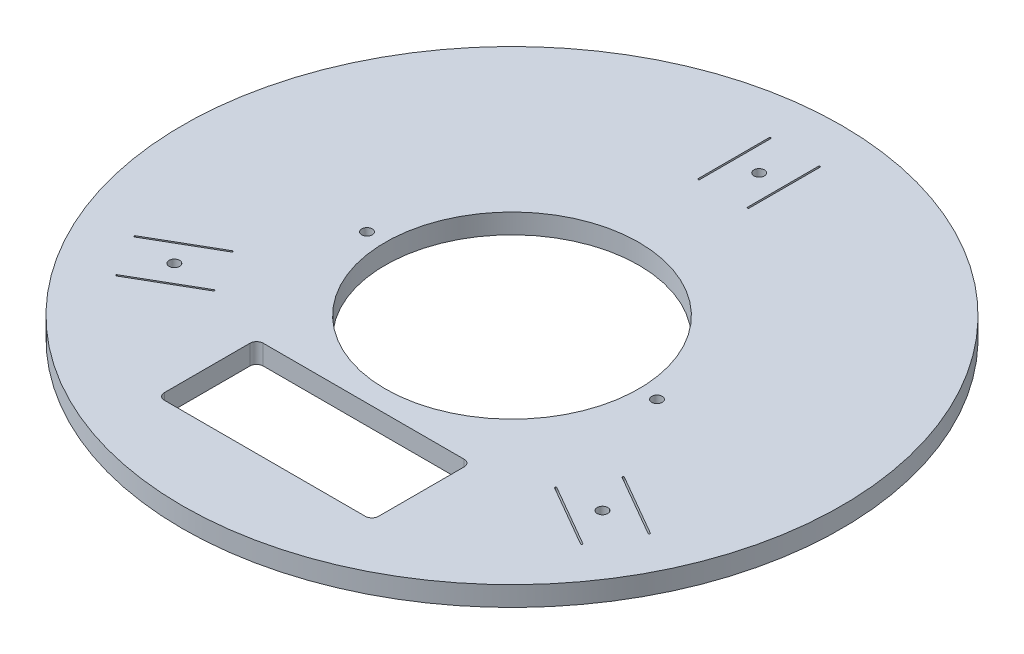
from build123d import *

# Parameters (mm, degrees)
SKETCH2_R           = 100
BOSS_EXTRUDE1_DEPTH = 6
SKETCH3_R           = 1.6
SKETCH3_W           = 0.5
SKETCH3_H           = 22
CUT_EXTRUDE1_DEPTH  = 142.548578234
SKETCH4_R           = 38.5
CUT_EXTRUDE2_DEPTH  = 142.548578234
SKETCH5_R           = 1.6
CUT_EXTRUDE3_DEPTH  = 142.548578234
SKETCH6_W           = 65
SKETCH6_H           = 30
CUT_EXTRUDE4_DEPTH  = 142.548578234
FILLET1_R           = 2
FILLET2_R           = 0.2


with BuildPart() as part:
    # Sketch2 → Boss-Extrude1 (new body)
    with BuildSketch(Plane(origin=(0, 0, 0), x_dir=(1, 0, 0), z_dir=(0, 1, 0))):
        Circle(SKETCH2_R)
    extrude(amount=BOSS_EXTRUDE1_DEPTH)

    # Sketch3 → Cut-Extrude1 (cut, through all)
    with BuildSketch(Plane(origin=(0, 6, 0), x_dir=(1, 0, 0), z_dir=(0, 1, 0))):
        with Locations((0, 75)):
            Circle(SKETCH3_R)
        with Locations((64.951905284, -37.5)):
            Circle(SKETCH3_R)
        with Locations((-64.951905284, -37.5)):
            Circle(SKETCH3_R)
        with Locations((-7.5, 75)):
            Rectangle(SKETCH3_W, SKETCH3_H)
        with Locations((7.5, 75)):
            Rectangle(SKETCH3_W, SKETCH3_H)
        Polygon((59.300625842, -25.288303121), (78.353184725, -36.288303121), (78.103184725, -36.721315823), (59.050625842, -25.721315823), align=None)
        Polygon((51.800625842, -38.278684177), (70.853184725, -49.278684177), (70.603184725, -49.711696879), (51.550625842, -38.711696879), align=None)
        Polygon((-51.550625842, -38.711696879), (-70.603184725, -49.711696879), (-70.853184725, -49.278684177), (-51.800625842, -38.278684177), align=None)
        Polygon((-59.050625842, -25.721315823), (-78.103184725, -36.721315823), (-78.353184725, -36.288303121), (-59.300625842, -25.288303121), align=None)
    extrude(amount=-CUT_EXTRUDE1_DEPTH, mode=Mode.SUBTRACT)

    # Sketch4 → Cut-Extrude2 (cut, through all)
    with BuildSketch(Plane(origin=(0, 6, 0), x_dir=(1, 0, 0), z_dir=(0, 1, 0))):
        Circle(SKETCH4_R)
    extrude(amount=-CUT_EXTRUDE2_DEPTH, mode=Mode.SUBTRACT)

    # Sketch5 → Cut-Extrude3 (cut, through all)
    with BuildSketch(Plane(origin=(0, 6, 0), x_dir=(1, 0, 0), z_dir=(0, 1, 0))):
        with Locations((-44, 0)):
            Circle(SKETCH5_R)
        with Locations((44, 0)):
            Circle(SKETCH5_R)
    extrude(amount=-CUT_EXTRUDE3_DEPTH, mode=Mode.SUBTRACT)

    # Sketch6 → Cut-Extrude4 (cut, through all)
    with BuildSketch(Plane(origin=(0, 6, 0), x_dir=(1, 0, 0), z_dir=(0, 1, 0))):
        with Locations((0, -60)):
            Rectangle(SKETCH6_W, SKETCH6_H)
    extrude(amount=-CUT_EXTRUDE4_DEPTH, mode=Mode.SUBTRACT)

    # Fillet1
    fillet1_edges = [part.edges().sort_by_distance(p)[0] for p in [
        (32.5, 3, 45),
        (32.5, 3, 75),
        (-32.5, 3, 75),
        (-32.5, 3, 45),
    ]]
    fillet(fillet1_edges, radius=FILLET1_R)

    # Fillet2
    fillet2_edges = [part.edges().sort_by_distance(p)[0] for p in [
        (-7.75, 3, -64),
        (-7.75, 3, -86),
        (-7.25, 3, -86),
        (-7.25, 3, -64),
        (-51.550625842, 3, 38.711696879),
        (-70.603184725, 3, 49.711696879),
        (-70.853184725, 3, 49.278684177),
        (-59.300625842, 3, 25.288303121),
        (-59.050625842, 3, 25.721315823),
        (-78.103184725, 3, 36.721315823),
        (-78.353184725, 3, 36.288303121),
        (51.550625842, 3, 38.711696879),
        (51.800625842, 3, 38.278684177),
        (70.853184725, 3, 49.278684177),
        (70.603184725, 3, 49.711696879),
        (59.050625842, 3, 25.721315823),
        (59.300625842, 3, 25.288303121),
        (78.353184725, 3, 36.288303121),
        (78.103184725, 3, 36.721315823),
        (7.25, 3, -64),
        (7.25, 3, -86),
        (7.75, 3, -86),
        (7.75, 3, -64),
        (-51.800625842, 3, 38.278684177),
    ]]
    fillet(fillet2_edges, radius=FILLET2_R)


solid = part.part
